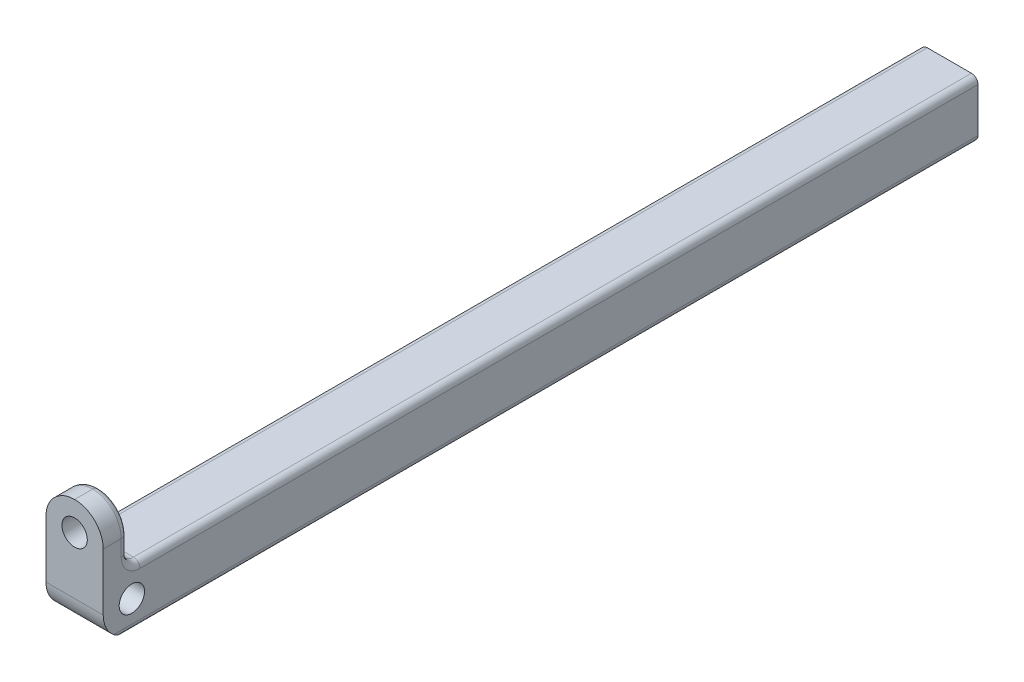
from build123d import *

# Parameters (mm, degrees)
SKETCH_1_W          = 7
SKETCH_1_H          = 7
EXTRUDE_1_DEPTH     = 107
FILLET_1_R          = 3.5
SKETCH_5_R          = 1.55
CUT_EXTRUDE_2_DEPTH = 108.285833175
SKETCH_6_W          = 7
SKETCH_6_H          = 3
EXTRUDE_2_DEPTH     = 7
FILLET_2_R          = 3.5
SKETCH_7_R          = 1.55
CUT_EXTRUDE_4_DEPTH = 105.587284122
FILLET_3_R          = 1.5
FILLET_4_R          = 0.8
FILLET_5_R          = 0.8


# Some blends are built 0.0001 mm under size
with BuildPart() as part:
    # 草图1 → 凸台-拉伸1 (new body)
    with BuildSketch(Plane.XY):
        Rectangle(SKETCH_1_W, SKETCH_1_H)
    extrude(amount=EXTRUDE_1_DEPTH)

    # 圆角1
    fillet_1_edges = [part.edges().sort_by_distance(p)[0] for p in [
        (0, -3.5, 107),
    ]]
    fillet(fillet_1_edges, radius=FILLET_1_R)

    # 草图5 → 切除-拉伸2 (cut, through all)
    with BuildSketch(Plane(origin=(3.5, 0, 0), x_dir=(0, 0, -1), z_dir=(1, 0, 0))):
        with Locations(Location((-103.5, 0, 0), (0, 0, 90))):
            Circle(SKETCH_5_R)
    extrude(amount=-CUT_EXTRUDE_2_DEPTH, mode=Mode.SUBTRACT)

    # 草图6 → 凸台-拉伸2 (add)
    with BuildSketch(Plane(origin=(0, 3.5, 0), x_dir=(1, 0, 0), z_dir=(0, 1, 0))):
        with Locations((0, -105.5)):
            Rectangle(SKETCH_6_W, SKETCH_6_H)
    extrude(amount=EXTRUDE_2_DEPTH)

    # 圆角2
    fillet_2_edges = [part.edges().sort_by_distance(p)[0] for p in [
        (3.5, 10.5, 105.5),
        (-3.5, 10.5, 105.5),
    ]]
    fillet(fillet_2_edges, radius=FILLET_2_R - 0.0001)  # a hair under: the kernel refuses the full size

    # 草图7 → 切除-拉伸4 (cut, through all)
    with BuildSketch(Plane(origin=(0, 0, 104), x_dir=(-1, 0, 0), z_dir=(0, 0, -1))):
        with Locations((0, 7)):
            Circle(SKETCH_7_R)
    extrude(amount=-CUT_EXTRUDE_4_DEPTH, mode=Mode.SUBTRACT)

    # 圆角3
    fillet_3_edges = [part.edges().sort_by_distance(p)[0] for p in [
        (0, 3.5, 104),
    ]]
    fillet(fillet_3_edges, radius=FILLET_3_R)

    # 圆角4
    fillet_4_edges = [part.edges().sort_by_distance(p)[0] for p in [
        (-3.5, 6.00005, 104),
        (3.5, 6.00005, 104),
        (-2.474903023, 9.474903023, 104),
        (2.474903023, 9.474903023, 104),
        (3.5, 3.5, 51.25),
        (-3.5, 3.5, 51.25),
        (-3.5, 3.939339828, 103.560660172),
        (3.5, 3.939339828, 103.560660172),
    ]]
    fillet(fillet_4_edges, radius=FILLET_4_R)

    # 圆角5
    # the kernel refuses this fillet: 0.8 mm, written as the material it takes off along each edge
    with BuildSketch(Plane(origin=(3.5, -3.5, -4.8), x_dir=(0, 1, 0), z_dir=(0, 0, 1)), Plane(origin=(-3.5, -3.5, -4.8), x_dir=(1, 0, 0), z_dir=(0, 0, 1))) as fillet_5_piece_1:
        with BuildLine():
            CenterArc((FILLET_5_R, FILLET_5_R), FILLET_5_R, 180, 90)
            Line((0, FILLET_5_R), (-FILLET_5_R * 0.02, FILLET_5_R))
            Line((-FILLET_5_R * 0.02, FILLET_5_R), (-FILLET_5_R * 0.02, -FILLET_5_R * 0.02))
            Line((-FILLET_5_R * 0.02, -FILLET_5_R * 0.02), (FILLET_5_R, -FILLET_5_R * 0.02))
            Line((FILLET_5_R, -FILLET_5_R * 0.02), (FILLET_5_R, 0))
        make_face()
    extrude(amount=113.1, mode=Mode.SUBTRACT)


solid = part.part
